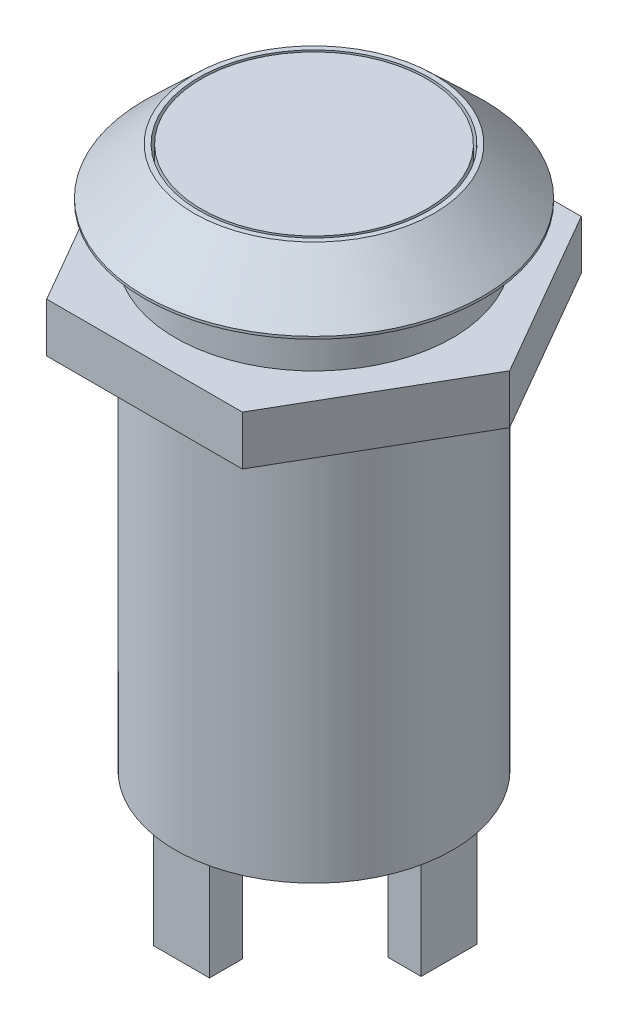
from build123d import *

# Parameters (mm, degrees)
SKETCH1_R               = 5.625
BOSS_EXTRUDE1_DEPTH     = 20
SKETCH2_R               = 6.875
BOSS_EXTRUDE2_DEPTH     = 2
SKETCH3_R               = 4.675
SKETCH3_R_2             = 4.575
CUT_EXTRUDE_THIN1_DEPTH = 2
CHAMFER1_SIZE           = 1.9
CHAMFER1_SIZE2          = 2
BOSS_EXTRUDE5_DEPTH     = 18
SKETCH6_R               = 5.625
CUT_EXTRUDE1_DEPTH      = 16
SKETCH5_W               = 2.267410979
SKETCH5_H               = 1.341149472
BOSS_EXTRUDE4_DEPTH     = 4
CIRPATTERN2_COUNT       = 4


with BuildPart() as part:
    # Sketch1 → Boss-Extrude1 (new body)
    with BuildSketch(Plane(origin=(0, 0, 0), x_dir=(1, 0, 0), z_dir=(0, 1, 0))):
        Circle(SKETCH1_R)
    extrude(amount=BOSS_EXTRUDE1_DEPTH)

    # Sketch2 → Boss-Extrude2 (add)
    with BuildSketch(Plane(origin=(0, 20, 0), x_dir=(1, 0, 0), z_dir=(0, 1, 0))):
        Circle(SKETCH2_R)
    extrude(amount=BOSS_EXTRUDE2_DEPTH)

    # Sketch3 → Cut-Extrude-Thin1 (cut)
    with BuildSketch(Plane(origin=(0, 22, 0), x_dir=(1, 0, 0), z_dir=(0, 1, 0))):
        Circle(SKETCH3_R)
        Circle(SKETCH3_R_2, mode=Mode.SUBTRACT)
    extrude(amount=-CUT_EXTRUDE_THIN1_DEPTH, mode=Mode.SUBTRACT)

    # Chamfer1
    chamfer1_edges = [part.edges().sort_by_distance(p)[0] for p in [
        (-6.875, 22, 0),
    ]]
    chamfer1_side = [part.faces().sort_by_distance(p)[0] for p in [
        (-6.875, 21, 0),
    ]]
    chamfer(chamfer1_edges, length=CHAMFER1_SIZE, length2=CHAMFER1_SIZE2, reference=chamfer1_side[0])

    # Sketch4 → Boss-Extrude5 (add)
    with BuildSketch(Plane.XZ):
        Polygon((3.969283101, 6.875), (-3.969283101, 6.875), (-7.938566201, 0), (-3.969283101, -6.875), (3.969283101, -6.875), (7.938566201, 0), align=None)
    extrude(amount=-BOSS_EXTRUDE5_DEPTH)

    # Sketch6 → Cut-Extrude1 (cut)
    with BuildSketch(Plane.XZ):
        Polygon((7.938566201, 0), (3.969283101, 6.875), (-3.969283101, 6.875), (-7.938566201, 0), (-3.969283101, -6.875), (3.969283101, -6.875), align=None)
        Circle(SKETCH6_R, mode=Mode.SUBTRACT)
    extrude(amount=-CUT_EXTRUDE1_DEPTH, mode=Mode.SUBTRACT)

    # Sketch5 → Boss-Extrude4 (add)
    with BuildSketch(Plane.XZ):
        with Locations((-0.053067066, -4.756738777)):
            Rectangle(SKETCH5_W, SKETCH5_H)
    boss_extrude4 = extrude(amount=BOSS_EXTRUDE4_DEPTH)

    # CirPattern2: Boss-Extrude4 ×4 about axis
    cirpattern2_axis = Axis((0, 0, 0), (0, -1, 0))
    for i in range(1, CIRPATTERN2_COUNT):
        add(boss_extrude4.rotate(cirpattern2_axis, i * 360 / CIRPATTERN2_COUNT))


solid = part.part
